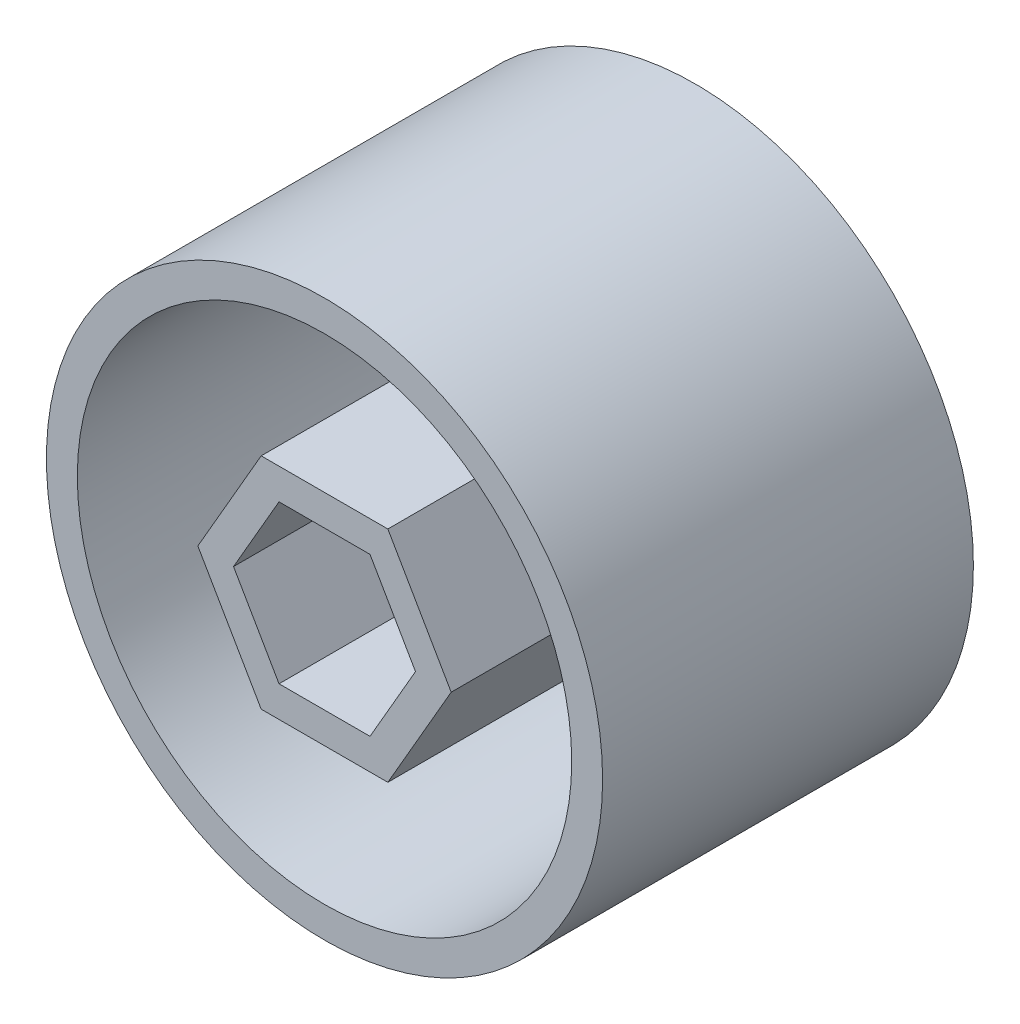
from build123d import *

# Parameters (mm, degrees)
EXTRUDE_1_DEPTH   = 24
SKETCH_1_R        = 18
SKETCH_1_R_2      = 16
EXTRUDE_1_2_DEPTH = 24
SKETCH_2_R        = 18
EXTRUDE_2_DEPTH   = 2


with BuildPart() as part:
    # 草图1 → 凸台-拉伸1 (new body)
    with BuildSketch(Plane.XY):
        Polygon((8.198373822, 0), (4.099186911, 7.1), (-4.099186911, 7.1), (-8.198373822, 0), (-4.099186911, -7.1), (4.099186911, -7.1), align=None)
        Polygon((2.944486373, 5.1), (5.888972746, 0), (2.944486373, -5.1), (-2.944486373, -5.1), (-5.888972746, 0), (-2.944486373, 5.1), align=None, mode=Mode.SUBTRACT)
    extrude(amount=EXTRUDE_1_DEPTH)



with BuildPart() as body_2:
    # 草图1 → Extrude 1 2 (new body)
    with BuildSketch(Plane.XY):
        Circle(SKETCH_1_R)
        Circle(SKETCH_1_R_2, mode=Mode.SUBTRACT)
    extrude(amount=EXTRUDE_1_2_DEPTH)


with BuildPart() as part_1:
    add(part.part)

    add(body_2.part)  # 凸台-拉伸2 merges body 2
    # 草图2 → 凸台-拉伸2 (add)
    with BuildSketch(Plane(origin=(0, 0, 0), x_dir=(-1, 0, 0), z_dir=(0, 0, -1))):
        Circle(SKETCH_2_R)
        Polygon((2.944486373, 5.1), (5.888972746, 0), (2.944486373, -5.1), (-2.944486373, -5.1), (-5.888972746, 0), (-2.944486373, 5.1), align=None, mode=Mode.SUBTRACT)
    extrude(amount=-EXTRUDE_2_DEPTH)


solid = part_1.part
